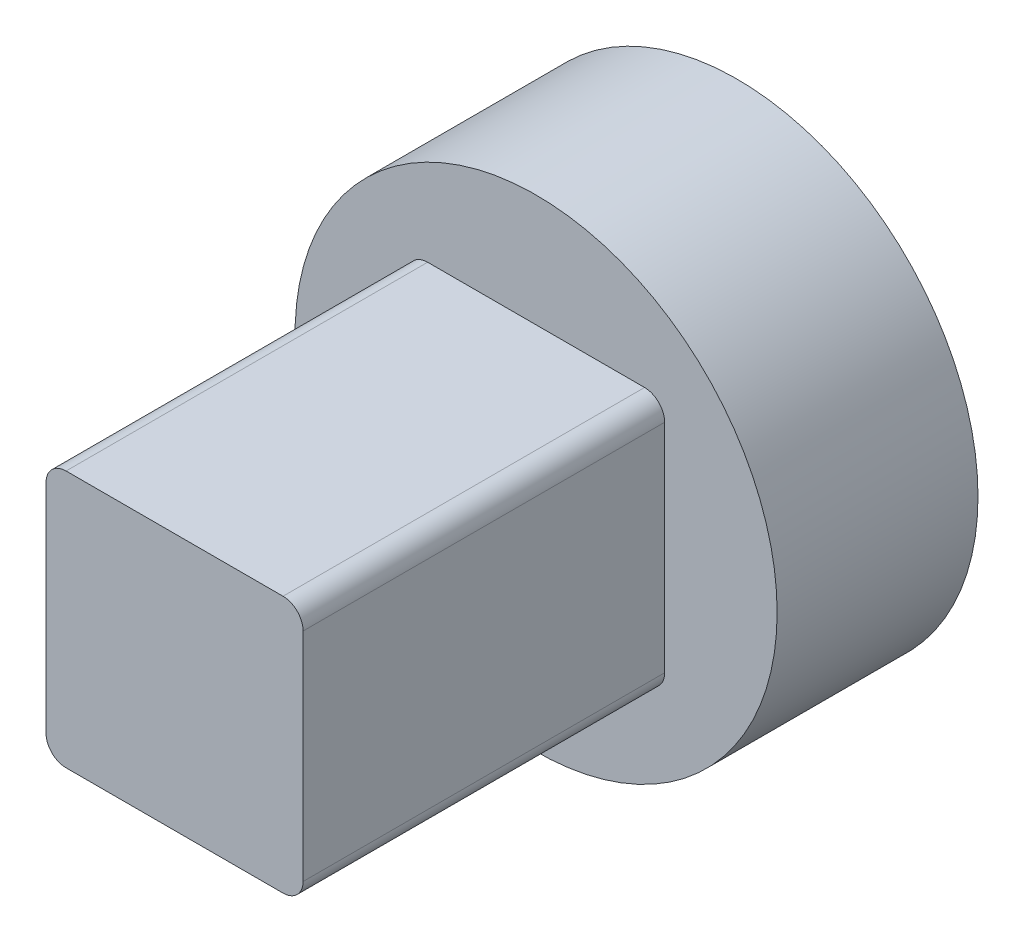
from build123d import *

# Parameters (mm, degrees)
SKETCH1_R           = 6
SKETCH1_R_2         = 2.5
BOSS_EXTRUDE1_DEPTH = 5
BOSS_EXTRUDE2_DEPTH = 9


with BuildPart() as part:
    # Sketch1 → Boss-Extrude1 (new body)
    with BuildSketch(Plane.XY.offset(-23.465471353)):
        with Locations((3.740457308, -31.828386779)):
            Circle(SKETCH1_R)
        with Locations((3.740457308, -31.828386779)):
            Circle(SKETCH1_R_2, mode=Mode.SUBTRACT)
    extrude(amount=BOSS_EXTRUDE1_DEPTH)

    # Sketch2 → Boss-Extrude2 (add)
    with BuildSketch(Plane.XY.offset(-18.465471353)):
        with BuildLine():
            Line((6.440457308, -28.628386779), (1.040457308, -28.628386779))
            ThreePointArc((1.040457308, -28.628386779), (0.686903918, -28.774833388), (0.540457308, -29.128386779))
            Line((0.540457308, -29.128386779), (0.540457308, -34.528386779))
            ThreePointArc((0.540457308, -34.528386779), (0.686903918, -34.881940169), (1.040457308, -35.028386779))
            Line((1.040457308, -35.028386779), (6.440457308, -35.028386779))
            ThreePointArc((6.440457308, -35.028386779), (6.794010699, -34.881940169), (6.940457308, -34.528386779))
            Line((6.940457308, -34.528386779), (6.940457308, -29.128386779))
            ThreePointArc((6.940457308, -29.128386779), (6.794010699, -28.774833388), (6.440457308, -28.628386779))
        make_face()
    extrude(amount=BOSS_EXTRUDE2_DEPTH)


solid = part.part
